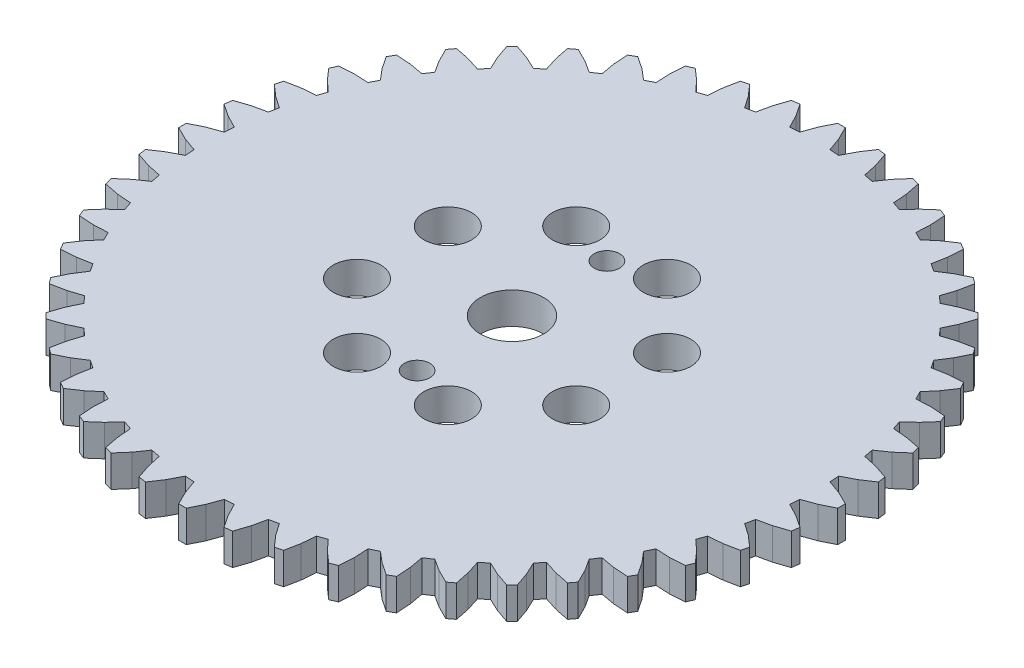
from build123d import *

# Parameters (mm, degrees)
BOSS_EXTRUDE2_DEPTH = 4
CUT_EXTRUDE1_REACH  = 67.976
SKETCH3_R           = 4
CUT_EXTRUDE2_REACH  = 67.976
SKETCH4_R           = 1.6
CUT_EXTRUDE3_REACH  = 67.976
SKETCH5_R           = 3
CIRPATTERN1_COUNT   = 8


with BuildPart() as part:
    # Sketch1 → Boss-Extrude2 (new body)
    with BuildSketch(Plane(origin=(0, 0, 0), x_dir=(1, 0, 0), z_dir=(0, 1, 0))):
        Polygon((42.670768214, 7.33199203), (44.364090179, 6.722783745), (46.049296244, 5.897590381), (46.049296244, 4.930501415), (44.364090179, 4.10530805), (42.670768214, 3.496099765), (42.593668553, 2.318392566), (44.192872884, 1.493330462), (45.756080243, 0.455162666), (45.629761993, -0.503548343), (43.851224003, -1.101761341), (42.092976227, -1.484774504), (41.862723156, -2.64232275), (43.340583693, -3.668971144), (44.754826389, -4.902310618), (44.504546088, -5.836412796), (42.663045168, -6.197303661), (40.869846795, -6.347576757), (40.490498727, -7.465069617), (41.821751264, -8.676025199), (43.062944581, -10.083330557), (42.692890512, -10.976722901), (40.819973758, -11.094271266), (39.022455841, -11.009186038), (38.500557723, -12.067643121), (39.662294716, -13.441830895), (40.709232397, -14.999147756), (40.225688377, -15.836645304), (38.353556868, -15.7087561), (36.582480794, -15.389753168), (35.926802973, -16.37097933), (36.899389583, -17.885098897), (37.734007744, -19.56572336), (37.14535034, -20.332928251), (35.305944489, -19.96169562), (33.591678325, -19.414272165), (32.813478148, -20.30164275), (33.58002859, -21.929645586), (34.188189572, -23.704910872), (33.504368159, -24.388732285), (31.729102873, -23.780570839), (30.101100501, -23.01402086), (29.213729452, -23.792221038), (29.761152907, -25.506486738), (30.132385538, -27.345893053), (29.365180648, -27.934549993), (27.684556184, -27.099932296), (26.170436617, -26.127345222), (25.189210455, -26.783023506), (25.508213387, -28.554099581), (25.636103055, -30.426230626), (24.798605043, -30.90977511), (23.241288182, -29.862837428), (21.867100409, -28.701100436), (20.808643325, -29.222998554), (20.893728553, -31.020516471), (20.776180188, -32.893433225), (19.882787844, -33.263487293), (18.475482486, -32.022293977), (17.264527368, -30.69104144), (16.147034045, -31.070389508), (15.996760948, -32.863587881), (15.635870083, -34.705088337), (14.701767905, -34.955369102), (13.468428431, -33.541125942), (12.441780037, -32.063265869), (11.284231792, -32.293518476), (10.901218628, -34.051766716), (10.30300563, -35.830304706), (9.344294621, -35.956622956), (8.306126825, -34.393415597), (7.481064721, -32.794210802), (6.303357522, -32.871310927), (5.694149237, -34.564632892), (4.868955873, -36.249838957), (3.901866906, -36.249838957), (3.076674006, -34.564632892), (2.467465257, -32.871310927), (1.289758521, -32.794210802), (0.464695954, -34.393415597), (-0.573471379, -35.956622956), (-1.532182851, -35.830304706), (-2.130395385, -34.051766716), (-2.513408549, -32.293518476), (-3.670957258, -32.063265869), (-4.697605189, -33.541125942), (-5.930944663, -34.955369102), (-6.865046841, -34.705088337), (-7.22593817, -32.863587881), (-7.376211266, -31.070389508), (-8.493704125, -30.69104144), (-9.704659707, -32.022293977), (-11.111965066, -33.263487293), (-12.005356946, -32.893433225), (-12.122905311, -31.020516471), (-12.037820547, -29.222998554), (-13.096277166, -28.701100436), (-14.470464939, -29.862837428), (-16.0277818, -30.90977511), (-16.865279812, -30.426230626), (-16.737390608, -28.554099581), (-16.418387213, -26.783023506), (-17.399613375, -26.127345222), (-18.913732941, -27.099932296), (-20.594357869, -27.934549993), (-21.361562296, -27.345893053), (-20.990330128, -25.506486738), (-20.442906209, -23.792221038), (-21.330277258, -23.01402086), (-22.958280095, -23.780570839), (-24.733544916, -24.388732285), (-25.41736633, -23.704910872), (-24.809205347, -21.929645586), (-24.042655369, -20.30164275), (-24.820855546, -19.414272165), (-26.535121247, -19.96169562), (-28.374527561, -20.332928251), (-28.963184502, -19.56572336), (-28.128566341, -17.885098897), (-27.155979731, -16.37097933), (-27.811657551, -15.389753168), (-29.582734089, -15.7087561), (-31.454865135, -15.836645304), (-31.938409618, -14.999147756), (-30.891471473, -13.441830895), (-29.72973448, -12.067643121), (-30.251632599, -11.009186038), (-32.049150979, -11.094271266), (-33.92206727, -10.976722901), (-34.292121802, -10.083330557), (-33.050928022, -8.676025199), (-31.719675485, -7.465069617), (-32.099023553, -6.347576757), (-33.89222239, -6.197303661), (-35.733722846, -5.836412796), (-35.98400361, -4.902310618), (-34.569760451, -3.668971144), (-33.091899913, -2.64232275), (-33.322152985, -1.484774504), (-35.080401224, -1.101761341), (-36.858938751, -0.503548343), (-36.985257465, 0.455162666), (-35.422050106, 1.493330462), (-33.822845311, 2.318392566), (-33.899945435, 3.496099765), (-35.593266937, 4.10530805), (-37.278473002, 4.930501415), (-37.278473002, 5.897590381), (-35.593266937, 6.722783745), (-33.899945435, 7.33199203), (-33.822845311, 8.509698766), (-35.422050106, 9.334761333), (-36.985257465, 10.372928666), (-36.858938751, 11.331640138), (-35.080401224, 11.929852672), (-33.322152985, 12.3128663), (-33.091899913, 13.470414546), (-34.569760451, 14.49706294), (-35.98400361, 15.73040195), (-35.733722846, 16.664504128), (-33.89222239, 17.025395457), (-32.099023553, 17.175668553), (-31.719675485, 18.293161413), (-33.050928022, 19.504116994), (-34.292121802, 20.911422353), (-33.92206727, 21.804814697), (-32.049150979, 21.922362598), (-30.251632599, 21.837277834), (-29.72973448, 22.895734917), (-30.891471473, 24.269922226), (-31.938409618, 25.827239088), (-31.454865135, 26.664737099), (-29.582734089, 26.536847895), (-27.811657551, 26.2178445), (-27.155979731, 27.199070662), (-28.128566341, 28.713190692), (-28.963184502, 30.393815156), (-28.374527561, 31.161019583), (-26.535121247, 30.789787415), (-24.820855546, 30.24236396), (-24.042655369, 31.129734545), (-24.809205347, 32.757737382), (-25.41736633, 34.533002667), (-24.733544916, 35.216823617), (-22.958280095, 34.608662635), (-21.330277258, 33.842112656), (-20.442906209, 34.620312834), (-20.990330128, 36.334578534), (-21.361562296, 38.173984848), (-20.594357869, 38.762641789), (-18.913732941, 37.928023628), (-17.399613375, 36.955437018), (-16.418387213, 37.611114838), (-16.737390608, 39.382191376), (-16.865279812, 41.254322422), (-16.0277818, 41.737866905), (-14.470464939, 40.690929224), (-13.096277166, 39.529191768), (-12.037820547, 40.051089886), (-12.122905311, 41.848608266), (-12.005356946, 43.721524557), (-11.111965066, 44.091579089), (-9.704659707, 42.850385772), (-8.493704125, 41.519133236), (-7.376211266, 41.898481304), (-7.22593817, 43.691679677), (-6.865046841, 45.533180133), (-5.930944663, 45.783460897), (-4.697605189, 44.369217738), (-3.670957258, 42.891357201), (-2.513408549, 43.121610272), (-2.130395385, 44.879858512), (-1.532182851, 46.658396038), (-0.573471379, 46.784714752), (0.464695954, 45.221507393), (1.289758521, 43.622302598), (2.467465257, 43.699402722), (3.076674006, 45.392724688), (3.901866906, 47.077930289), (4.868955873, 47.077930289), (5.694149237, 45.392724688), (6.303357522, 43.699402722), (7.481064721, 43.622302598), (8.306126825, 45.221507393), (9.344294621, 46.784714752), (10.30300563, 46.658396038), (10.901218628, 44.879858512), (11.284231792, 43.121610272), (12.441780037, 42.891357201), (13.468428431, 44.369217738), (14.701767905, 45.783460897), (15.635870083, 45.533180133), (15.996760948, 43.691679677), (16.147034045, 41.898481304), (17.264527368, 41.519133236), (18.475482486, 42.850385772), (19.882787844, 44.091579089), (20.776180188, 43.721524557), (20.893728553, 41.848608266), (20.808643325, 40.051089886), (21.867100409, 39.529191768), (23.241288182, 40.690929224), (24.798605043, 41.737866905), (25.636103055, 41.254322422), (25.508213387, 39.382191376), (25.189210455, 37.611114838), (26.170436617, 36.955437018), (27.684556184, 37.928023628), (29.365180648, 38.762641789), (30.132385538, 38.173984848), (29.761152907, 36.334578534), (29.213729452, 34.620312834), (30.101100501, 33.842112656), (31.729102873, 34.608662635), (33.504368159, 35.216823617), (34.188189572, 34.533002667), (33.58002859, 32.757737382), (32.813478148, 31.129734545), (33.591678325, 30.24236396), (35.305944489, 30.789787415), (37.14535034, 31.161019583), (37.734007744, 30.393815156), (36.899389583, 28.713190692), (35.926802973, 27.199070662), (36.582480794, 26.2178445), (38.353556868, 26.536847895), (40.225688377, 26.664737099), (40.709232397, 25.827239088), (39.662294716, 24.269922226), (38.500557723, 22.895734917), (39.022455841, 21.837277834), (40.819973758, 21.922362598), (42.692890512, 21.804814697), (43.062944581, 20.911422353), (41.821751264, 19.504116994), (40.490498727, 18.293161413), (40.869846795, 17.175668553), (42.663045168, 17.025395457), (44.504546088, 16.664504128), (44.754826389, 15.73040195), (43.340583693, 14.49706294), (41.862723156, 13.470414546), (42.092976227, 12.3128663), (43.851224003, 11.929852672), (45.629761993, 11.331640138), (45.756080243, 10.372928666), (44.192872884, 9.334761333), (42.593668553, 8.509698766), align=None)
    extrude(amount=BOSS_EXTRUDE2_DEPTH)

    # Sketch3 → Cut-Extrude1 (cut, up to next)
    with BuildSketch(Plane(origin=(0, 0, 0), x_dir=(1, 0, 0), z_dir=(0, 1, 0)), mode=Mode.PRIVATE) as cut_extrude1_sk1:
        with Locations((4.385411621, 5.414045898)):
            Circle(SKETCH3_R)
    cut_extrude1_tool1 = extrude(cut_extrude1_sk1.sketch, amount=CUT_EXTRUDE1_REACH, mode=Mode.PRIVATE) & part.part
    add(cut_extrude1_tool1.solids().sort_by_distance((4.385412, 0, -5.414046))[0], mode=Mode.SUBTRACT)

    # Sketch4 → Cut-Extrude2 (cut, up to next)
    with BuildSketch(Plane(origin=(0, 0, 0), x_dir=(1, 0, 0), z_dir=(0, 1, 0)), mode=Mode.PRIVATE) as cut_extrude2_sk1:
        with Locations((4.385411389, 17.414045898)):
            Circle(SKETCH4_R)
    cut_extrude2_tool1 = extrude(cut_extrude2_sk1.sketch, amount=CUT_EXTRUDE2_REACH, mode=Mode.PRIVATE) & part.part
    # Sketch4 → Cut-Extrude2 (cut, up to next)
    with BuildSketch(Plane(origin=(0, 0, 0), x_dir=(1, 0, 0), z_dir=(0, 1, 0)), mode=Mode.PRIVATE) as cut_extrude2_sk2:
        with Locations((4.385411389, -6.585954102)):
            Circle(SKETCH4_R)
    cut_extrude2_tool2 = extrude(cut_extrude2_sk2.sketch, amount=CUT_EXTRUDE2_REACH, mode=Mode.PRIVATE) & part.part
    add(cut_extrude2_tool1.solids().sort_by_distance((4.385411, 0, -17.414046))[0], mode=Mode.SUBTRACT)
    add(cut_extrude2_tool2.solids().sort_by_distance((4.385411, 0, 6.585954))[0], mode=Mode.SUBTRACT)

    # Sketch5 → Cut-Extrude3 (cut, up to next)
    with BuildSketch(Plane(origin=(0, 0, 0), x_dir=(1, 0, 0), z_dir=(0, 1, 0)), mode=Mode.PRIVATE) as cut_extrude3_sk1:
        with Locations((10.125663107, 19.272238885)):
            Circle(SKETCH5_R)
    cut_extrude3_tool1 = extrude(cut_extrude3_sk1.sketch, amount=CUT_EXTRUDE3_REACH, mode=Mode.PRIVATE) & part.part
    cut_extrude3 = cut_extrude3_tool1.solids().sort_by_distance((10.125663, 0, -19.272239))[0]
    add(cut_extrude3, mode=Mode.SUBTRACT)

    # CirPattern1: Cut-Extrude3 ×8 about axis
    cirpattern1_axis = Axis((4.385411621, 4, -5.414045898), (0, -1, 0))
    for i in range(1, CIRPATTERN1_COUNT):
        add(cut_extrude3.rotate(cirpattern1_axis, i * 360 / CIRPATTERN1_COUNT), mode=Mode.SUBTRACT)


solid = part.part
